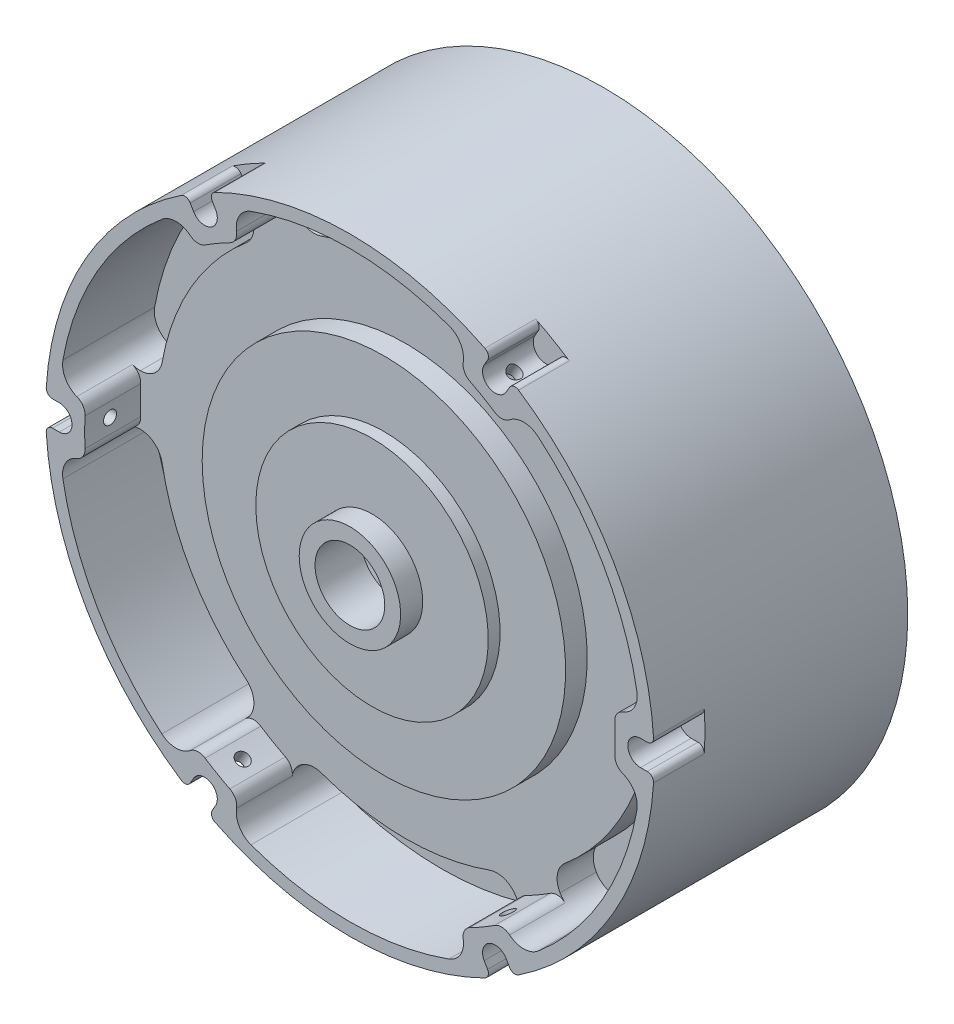
from build123d import *
from build123d.topology import SkipClean

# Parameters (mm, degrees)
SKETCH5_R                        = 8.73125
CUT_EXTRUDE2_DEPTH               = 126.080494083
BOSS_EXTRUDE2_REACH              = 127.08
CUT_EXTRUDE4_DEPTH               = 12.7
F_30_0_1285_DIAMETER_HOLE1_D     = 3.2639
F_30_0_1285_DIAMETER_HOLE1_DEPTH = 14.614001946
FILLET3_R                        = 5.55625
FILLET5_R                        = 1.5875
CIRPATTERN3_COUNT                = 6
FILLET3_OF_CIRPATTERN3_R         = 5.55625
FILLET5_OF_CIRPATTERN3_R         = 1.5875
SKETCH15_R                       = 66.421
SKETCH15_R_2                     = 61.585998054
CUT_EXTRUDE6_DEPTH               = 13.916871924
FILLET6_R                        = 3.175


# Some blends are built 0.0001 mm under size
with BuildPart() as part:
    # Sketch2 → Revolve1 (revolve)
    with BuildSketch(Plane(origin=(0, 0, 0), x_dir=(1, 0, 0), z_dir=(0, 1, 0))):
        with BuildLine():
            Line((0, 11.176), (0, 0))
            Line((0, 0), (-12.7, 0))
            Line((-12.7, 0), (-12.7, 5.536260026))
            Line((-12.7, 5.536260026), (-29.104166667, 5.536260026))
            Line((-29.104166667, 5.536260026), (-29.104166667, 8.510322958))
            Line((-29.104166667, 8.510322958), (-45.508333333, 8.510322958))
            Line((-45.508333333, 8.510322958), (-45.508333333, 13.916871924))
            Line((-45.508333333, 13.916871924), (-61.9125, 13.916871924))
            Line((-61.9125, 13.916871924), (-61.9125, 22.980468166))
            Line((-61.9125, 22.980468166), (-73.025, 22.980468166))
            Line((-73.025, 22.980468166), (-73.025, 0))
            Line((-73.025, 0), (-76.2, 0))
            Line((-76.2, 0), (-76.2, 46.101))
            Line((-76.2, 46.101), (-76.2, 63.5))
            Line((-76.2, 63.5), (-69.85, 63.5))
            Line((-69.85, 63.5), (-69.85, 46.101))
            add(Edge.make_bspline(
                [(-69.85, 46.101), (-69.85, 11.176), (0, 11.176)],
                knots=[3.141592654, 3.141592654, 3.141592654, 4.71238898, 4.71238898, 4.71238898], degree=2, weights=[1, 0.707106781, 1]))
        make_face()
    revolve(axis=Axis((0, 0, -46.101), (0, 0, 1)))

    # Sketch5 → Cut-Extrude2 (cut, through all)
    with BuildSketch(Plane.XY):
        Circle(SKETCH5_R)
    extrude(amount=-CUT_EXTRUDE2_DEPTH, mode=Mode.SUBTRACT)

    # Boss-Extrude2: up to this face of the body (flat: up to its plane)
    boss_extrude2_end = Plane(part.part.faces().sort_by_distance((63.977958908, 0, -22.980468166))[0])
    # Sketch11 → Boss-Extrude2 (add, up to the picked face)
    with BuildSketch(Plane.XY, mode=Mode.PRIVATE) as boss_extrude2_sk1:
        with BuildLine():
            ThreePointArc((-75.934955719, 6.35), (-74.871667083, 4.6896715), (-76.133825433, 3.175))
            Line((-76.133825433, 3.175), (-72.771, 3.175))
            ThreePointArc((-72.771, 3.175), (-69.596, 0), (-72.771, -3.175))
            Line((-72.771, -3.175), (-76.133825433, -3.175))
            ThreePointArc((-76.133825433, -3.175), (-74.763294431, -4.682883456), (-75.934955719, -6.35))
            Line((-75.934955719, -6.35), (-61.585998054, -6.35))
            Line((-61.585998054, -6.35), (-61.585998054, 6.35))
            Line((-61.585998054, 6.35), (-75.934955719, 6.35))
        make_face()
    boss_extrude2_tool1 = split(extrude(boss_extrude2_sk1.sketch, amount=-BOSS_EXTRUDE2_REACH, mode=Mode.PRIVATE), bisect_by=boss_extrude2_end, keep=Keep.BOTH, mode=Mode.PRIVATE)
    # Sketch11 → Boss-Extrude2 (add, up to the picked face)
    with BuildSketch(Plane.XY, mode=Mode.PRIVATE) as boss_extrude2_sk2:
        with BuildLine():
            Line((-72.771, 3.175), (-76.133825433, 3.175))
            ThreePointArc((-76.133825433, 3.175), (-76.2, 0), (-76.133825433, -3.175))
            Line((-76.133825433, -3.175), (-72.771, -3.175))
            ThreePointArc((-72.771, -3.175), (-69.596, 0), (-72.771, 3.175))
        make_face()
    boss_extrude2_tool2 = split(extrude(boss_extrude2_sk2.sketch, amount=-BOSS_EXTRUDE2_REACH, mode=Mode.PRIVATE), bisect_by=boss_extrude2_end, keep=Keep.BOTH, mode=Mode.PRIVATE)
    boss_extrude2_1 = boss_extrude2_tool1.solids().sort_by(Axis((-67.423428, 0.010074, 0), (0, 0, -1)))[0]
    add(boss_extrude2_1)
    boss_extrude2_2 = boss_extrude2_tool2.solids().sort_by(Axis((-73.185133, 0, 0), (0, 0, -1)))[0]
    add(boss_extrude2_2)
    boss_extrude2 = boss_extrude2_1 + boss_extrude2_2  # Boss-Extrude2 as one shape, for the pattern or mirror that repeats it

    # Sketch12 → Cut-Extrude4 (cut)
    with BuildSketch(Plane.XY):
        with BuildLine():
            Line((-76.133825433, 3.175), (-72.771, 3.175))
            ThreePointArc((-72.771, 3.175), (-69.596, 0), (-72.771, -3.175))
            Line((-72.771, -3.175), (-76.133825433, -3.175))
            ThreePointArc((-76.133825433, -3.175), (-79.308825433, 0), (-76.133825433, 3.175))
        make_face()
    cut_extrude4 = extrude(amount=-CUT_EXTRUDE4_DEPTH, mode=Mode.SUBTRACT)

    # #30 (0.1285) Diameter Hole1
    with Locations(Plane(origin=(-61.585998054, 0, 0), x_dir=(0, 0, -1), z_dir=(1, 0, 0))):
        with Locations((6.35, 0)):
            f_30_0_1285_diameter_hole1 = Hole(F_30_0_1285_DIAMETER_HOLE1_D / 2, depth=F_30_0_1285_DIAMETER_HOLE1_DEPTH)

    # Fillet3
    fillet3_edges = [part.edges().sort_by_distance(p)[0] for p in [
        (-72.748389157, -6.35, -11.490234083),
        (-72.748389157, 6.35, -11.490234083),
        (-61.585998054, -6.35, -18.448670045),
        (-61.585998054, 6.35, -18.448670045),
    ]]
    fillet(fillet3_edges, radius=FILLET3_R - 0.0001)  # a hair under: the kernel refuses the full size

    # Fillet5
    fillet5_edges = [part.edges().sort_by_distance(p)[0] for p in [
        (-76.133825433, -3.175, -6.35),
        (-76.133825433, 3.175, -6.35),
    ]]
    fillet(fillet5_edges, radius=FILLET5_R)

    # CirPattern3: Boss-Extrude2, Cut-Extrude4, #30 (0.1285) Diameter Hole1 ×6 about axis
    with SkipClean():  # the faces are left unmerged after this step: merging them gives an invalid solid
        cirpattern3_axis = Axis((0, 0, 0), (0, 0, 1))
        add([boss_extrude2.rotate(cirpattern3_axis, i * 360 / CIRPATTERN3_COUNT) for i in range(1, CIRPATTERN3_COUNT)])
        add([cut_extrude4.rotate(cirpattern3_axis, i * 360 / CIRPATTERN3_COUNT) for i in range(1, CIRPATTERN3_COUNT)], mode=Mode.SUBTRACT)
        add([f_30_0_1285_diameter_hole1.rotate(cirpattern3_axis, i * 360 / CIRPATTERN3_COUNT) for i in range(1, CIRPATTERN3_COUNT)], mode=Mode.SUBTRACT)

    # Fillet3 of CirPattern3
    fillet3_of_cirpattern3_edges = [part.edges().sort_by_distance(p)[0] for p in [
        (-30.874933265, -66.176953095, -11.490234083),
        (-41.873455893, -59.826953095, -11.490234083),
        (-25.293737713, -56.510038832, -18.448670045),
        (-36.292260341, -50.160038832, -18.448670045),
        (41.873455893, -59.826953095, -11.490234083),
        (30.874933265, -66.176953095, -11.490234083),
        (36.292260341, -50.160038832, -18.448670045),
        (25.293737713, -56.510038832, -18.448670045),
        (72.748389157, 6.35, -11.490234083),
        (72.748389157, -6.35, -11.490234083),
        (61.585998054, 6.35, -18.448670045),
        (61.585998054, -6.35, -18.448670045),
        (30.874933265, 66.176953095, -11.490234083),
        (41.873455893, 59.826953095, -11.490234083),
        (25.293737713, 56.510038832, -18.448670045),
        (36.292260341, 50.160038832, -18.448670045),
        (-41.873455893, 59.826953095, -11.490234083),
        (-30.874933265, 66.176953095, -11.490234083),
        (-36.292260341, 50.160038832, -18.448670045),
        (-25.293737713, 56.510038832, -18.448670045),
    ]]
    fillet(fillet3_of_cirpattern3_edges, radius=FILLET3_OF_CIRPATTERN3_R - 0.0001)  # a hair under: the kernel refuses the full size

    # Fillet5 of CirPattern3
    fillet5_of_cirpattern3_edges = [part.edges().sort_by_distance(p)[0] for p in [
        (-35.317282059, -67.521326912, -6.35),
        (-40.816543373, -64.346326912, -6.35),
        (40.816543373, -64.346326912, -6.35),
        (35.317282059, -67.521326912, -6.35),
        (76.133825433, 3.175, -6.35),
        (76.133825433, -3.175, -6.35),
        (35.317282059, 67.521326912, -6.35),
        (40.816543373, 64.346326912, -6.35),
        (-40.816543373, 64.346326912, -6.35),
        (-35.317282059, 67.521326912, -6.35),
    ]]
    fillet(fillet5_of_cirpattern3_edges, radius=FILLET5_OF_CIRPATTERN3_R)

    # Sketch15 → Cut-Extrude6 (cut)
    with BuildSketch(Plane.XY):
        Circle(SKETCH15_R)
        Circle(SKETCH15_R_2, mode=Mode.SUBTRACT)
    extrude(amount=-CUT_EXTRUDE6_DEPTH, mode=Mode.SUBTRACT)

    # Fillet6
    # the kernel refuses this fillet: 3.175 mm, written as the material it takes off along each edge
    with BuildSketch(Plane(origin=(-66.11676596, 6.35, -20.891780238), x_dir=(-0.07467528950499881, -0.997207902664908, 0), z_dir=(0, 0, 1))) as fillet6_piece_1_section:
        with BuildLine():
            CenterArc((2.856644804, -3.174299694), FILLET6_R, 91.203421084, 72.384247986)
            Line((-0.188984069, -2.277210082), (-0.493546956, -2.187501121))
            ThreePointArc((-0.493546956, -2.187501121), (-0.294715491, -0.31613381), (-0.316613509, -0.023709404))
            Line((-0.316613509, -0.023709404), (0.006668172, 0.317429969))
            ThreePointArc((0.006668172, 0.317429969), (1.394981543, 0.302849602), (2.783294914, 0.317429969))
            Line((2.783294914, 0.317429969), (2.789963085, 0))
        make_face()
    fillet6_piece_1 = extrude(amount=27.866687951, mode=Mode.PRIVATE)
    fillet6_piece_1 = split(fillet6_piece_1, bisect_by=Plane(origin=(-66.627757275, 5.727640157, -13.916871924), z_dir=(0, 0, 1)), keep=Keep.TOP, mode=Mode.PRIVATE)
    add(fillet6_piece_1, mode=Mode.SUBTRACT)
    with BuildSketch(Plane(origin=(-66.11676596, -6.35, -20.891780238), x_dir=(-0.9876155238906309, -0.1568935211225585, 0), z_dir=(0, 0, 1))) as fillet6_piece_2_section:
        with BuildLine():
            CenterArc((2.927166017, -3.109388556), FILLET6_R, 101.66826556, 72.384247986)
            Line((-0.230743852, -2.780404879), (-0.546534839, -2.747506512))
            ThreePointArc((-0.546534839, -2.747506512), (-0.417183988, -1.365155268), (-0.316893969, 0.019607713))
            Line((-0.316893969, 0.019607713), (0.049813693, 0.313567929))
            ThreePointArc((0.049813693, 0.313567929), (0.339425199, 0.267559976), (2.220825698, 0.310938856))
            Line((2.220825698, 0.310938856), (2.285038454, 0))
        make_face()
    fillet6_piece_2 = extrude(amount=27.866687951, mode=Mode.PRIVATE)
    fillet6_piece_2 = split(fillet6_piece_2, bisect_by=Plane(origin=(-66.627757275, -5.727640157, -13.916871924), z_dir=(0, 0, 1)), keep=Keep.TOP, mode=Mode.PRIVATE)
    add(fillet6_piece_2, mode=Mode.SUBTRACT)
    with BuildSketch(Plane(origin=(38.557644294, 54.083798937, -20.891780238), x_dir=(-0.8262697318099086, 0.5632746490787435, 0), z_dir=(0, 0, 1))) as fillet6_piece_3_section:
        with BuildLine():
            CenterArc((2.856644804, -3.174299694), FILLET6_R, 91.203421084, 72.384247986)
            Line((-0.188984069, -2.277210082), (-0.493546956, -2.187501121))
            ThreePointArc((-0.493546956, -2.187501121), (-0.294715491, -0.31613381), (-0.316613509, -0.023709404))
            Line((-0.316613509, -0.023709404), (0.006668172, 0.317429969))
            ThreePointArc((0.006668172, 0.317429969), (1.394981543, 0.302849602), (2.783294914, 0.317429969))
            Line((2.783294914, 0.317429969), (2.789963085, 0))
        make_face()
    fillet6_piece_3 = extrude(amount=27.866687951, mode=Mode.PRIVATE)
    fillet6_piece_3 = split(fillet6_piece_3, bisect_by=Plane(origin=(38.274160518, 54.837510319, -13.916871924), z_dir=(0, 0, 1)), keep=Keep.TOP, mode=Mode.PRIVATE)
    add(fillet6_piece_3, mode=Mode.SUBTRACT)
    with BuildSketch(Plane(origin=(-38.557644294, 54.083798937, -20.891780238), x_dir=(-0.6296815369266403, 0.7768533722998853, 0), z_dir=(0, 0, 1))) as fillet6_piece_4_section:
        with BuildLine():
            CenterArc((2.927166017, -3.109388556), FILLET6_R, 101.66826556, 72.384247986)
            Line((-0.230743852, -2.780404879), (-0.546534839, -2.747506512))
            ThreePointArc((-0.546534839, -2.747506512), (-0.417183988, -1.365155268), (-0.316893969, 0.019607713))
            Line((-0.316893969, 0.019607713), (0.049813693, 0.313567929))
            ThreePointArc((0.049813693, 0.313567929), (0.339425199, 0.267559976), (2.220825698, 0.310938856))
            Line((2.220825698, 0.310938856), (2.285038454, 0))
        make_face()
    fillet6_piece_4 = extrude(amount=27.866687951, mode=Mode.PRIVATE)
    fillet6_piece_4 = split(fillet6_piece_4, bisect_by=Plane(origin=(-38.274160518, 54.837510319, -13.916871924), z_dir=(0, 0, 1)), keep=Keep.TOP, mode=Mode.PRIVATE)
    add(fillet6_piece_4, mode=Mode.SUBTRACT)
    with BuildSketch(Plane(origin=(-27.559121666, 60.433798937, -20.891780238), x_dir=(-0.9009450213149103, -0.4339332535861662, 0), z_dir=(0, 0, 1))) as fillet6_piece_5_section:
        with BuildLine():
            CenterArc((2.856644804, -3.174299694), FILLET6_R, 91.203421084, 72.384247986)
            Line((-0.188984069, -2.277210082), (-0.493546956, -2.187501121))
            ThreePointArc((-0.493546956, -2.187501121), (-0.294715491, -0.31613381), (-0.316613509, -0.023709404))
            Line((-0.316613509, -0.023709404), (0.006668172, 0.317429969))
            ThreePointArc((0.006668172, 0.317429969), (1.394981543, 0.302849602), (2.783294914, 0.317429969))
            Line((2.783294914, 0.317429969), (2.789963085, 0))
        make_face()
    fillet6_piece_5 = extrude(amount=27.866687951, mode=Mode.PRIVATE)
    fillet6_piece_5 = split(fillet6_piece_5, bisect_by=Plane(origin=(-28.353596758, 60.565150476, -13.916871924), z_dir=(0, 0, 1)), keep=Keep.TOP, mode=Mode.PRIVATE)
    add(fillet6_piece_5, mode=Mode.SUBTRACT)
    with BuildSketch(Plane(origin=(27.559121666, 60.433798937, -20.891780238), x_dir=(0.35793398696398865, 0.933746893422443, 0), z_dir=(0, 0, 1))) as fillet6_piece_6_section:
        with BuildLine():
            CenterArc((2.927166017, -3.109388556), FILLET6_R, 101.66826556, 72.384247986)
            Line((-0.230743852, -2.780404879), (-0.546534839, -2.747506512))
            ThreePointArc((-0.546534839, -2.747506512), (-0.417183988, -1.365155268), (-0.316893969, 0.019607713))
            Line((-0.316893969, 0.019607713), (0.049813693, 0.313567929))
            ThreePointArc((0.049813693, 0.313567929), (0.339425199, 0.267559976), (2.220825698, 0.310938856))
            Line((2.220825698, 0.310938856), (2.285038454, 0))
        make_face()
    fillet6_piece_6 = extrude(amount=27.866687951, mode=Mode.PRIVATE)
    fillet6_piece_6 = split(fillet6_piece_6, bisect_by=Plane(origin=(28.353596758, 60.565150476, -13.916871924), z_dir=(0, 0, 1)), keep=Keep.TOP, mode=Mode.PRIVATE)
    add(fillet6_piece_6, mode=Mode.SUBTRACT)
    with BuildSketch(Plane(origin=(66.11676596, -6.35, -20.891780238), x_dir=(0.0746752895049996, 0.997207902664908, 0), z_dir=(0, 0, 1))) as fillet6_piece_7_section:
        with BuildLine():
            CenterArc((2.856644804, -3.174299694), FILLET6_R, 91.203421084, 72.384247986)
            Line((-0.188984069, -2.277210082), (-0.493546956, -2.187501121))
            ThreePointArc((-0.493546956, -2.187501121), (-0.294715491, -0.31613381), (-0.316613509, -0.023709404))
            Line((-0.316613509, -0.023709404), (0.006668172, 0.317429969))
            ThreePointArc((0.006668172, 0.317429969), (1.394981543, 0.302849602), (2.783294914, 0.317429969))
            Line((2.783294914, 0.317429969), (2.789963085, 0))
        make_face()
    fillet6_piece_7 = extrude(amount=27.866687951, mode=Mode.PRIVATE)
    fillet6_piece_7 = split(fillet6_piece_7, bisect_by=Plane(origin=(66.627757275, -5.727640157, -13.916871924), z_dir=(0, 0, 1)), keep=Keep.TOP, mode=Mode.PRIVATE)
    add(fillet6_piece_7, mode=Mode.SUBTRACT)
    with BuildSketch(Plane(origin=(66.11676596, 6.35, -20.891780238), x_dir=(0.9876155238906308, 0.15689352112255867, 0), z_dir=(0, 0, 1))) as fillet6_piece_8_section:
        with BuildLine():
            CenterArc((2.927166017, -3.109388556), FILLET6_R, 101.66826556, 72.384247986)
            Line((-0.230743852, -2.780404879), (-0.546534839, -2.747506512))
            ThreePointArc((-0.546534839, -2.747506512), (-0.417183988, -1.365155268), (-0.316893969, 0.019607713))
            Line((-0.316893969, 0.019607713), (0.049813693, 0.313567929))
            ThreePointArc((0.049813693, 0.313567929), (0.339425199, 0.267559976), (2.220825698, 0.310938856))
            Line((2.220825698, 0.310938856), (2.285038454, 0))
        make_face()
    fillet6_piece_8 = extrude(amount=27.866687951, mode=Mode.PRIVATE)
    fillet6_piece_8 = split(fillet6_piece_8, bisect_by=Plane(origin=(66.627757275, 5.727640157, -13.916871924), z_dir=(0, 0, 1)), keep=Keep.TOP, mode=Mode.PRIVATE)
    add(fillet6_piece_8, mode=Mode.SUBTRACT)
    with BuildSketch(Plane(origin=(38.557644294, -54.083798937, -20.891780238), x_dir=(0.6296815369266422, -0.7768533722998838, 0), z_dir=(0, 0, 1))) as fillet6_piece_9_section:
        with BuildLine():
            CenterArc((2.927166017, -3.109388556), FILLET6_R, 101.66826556, 72.384247986)
            Line((-0.230743852, -2.780404879), (-0.546534839, -2.747506512))
            ThreePointArc((-0.546534839, -2.747506512), (-0.417183988, -1.365155268), (-0.316893969, 0.019607713))
            Line((-0.316893969, 0.019607713), (0.049813693, 0.313567929))
            ThreePointArc((0.049813693, 0.313567929), (0.339425199, 0.267559976), (2.220825698, 0.310938856))
            Line((2.220825698, 0.310938856), (2.285038454, 0))
        make_face()
    fillet6_piece_9 = extrude(amount=27.866687951, mode=Mode.PRIVATE)
    fillet6_piece_9 = split(fillet6_piece_9, bisect_by=Plane(origin=(38.274160518, -54.837510319, -13.916871924), z_dir=(0, 0, 1)), keep=Keep.TOP, mode=Mode.PRIVATE)
    add(fillet6_piece_9, mode=Mode.SUBTRACT)
    with BuildSketch(Plane(origin=(27.559121666, -60.433798937, -20.891780238), x_dir=(0.90094502131491, 0.4339332535861667, 0), z_dir=(0, 0, 1))) as fillet6_piece_10_section:
        with BuildLine():
            CenterArc((2.856644804, -3.174299694), FILLET6_R, 91.203421084, 72.384247986)
            Line((-0.188984069, -2.277210082), (-0.493546956, -2.187501121))
            ThreePointArc((-0.493546956, -2.187501121), (-0.294715491, -0.31613381), (-0.316613509, -0.023709404))
            Line((-0.316613509, -0.023709404), (0.006668172, 0.317429969))
            ThreePointArc((0.006668172, 0.317429969), (1.394981543, 0.302849602), (2.783294914, 0.317429969))
            Line((2.783294914, 0.317429969), (2.789963085, 0))
        make_face()
    fillet6_piece_10 = extrude(amount=27.866687951, mode=Mode.PRIVATE)
    fillet6_piece_10 = split(fillet6_piece_10, bisect_by=Plane(origin=(28.353596758, -60.565150476, -13.916871924), z_dir=(0, 0, 1)), keep=Keep.TOP, mode=Mode.PRIVATE)
    add(fillet6_piece_10, mode=Mode.SUBTRACT)
    with BuildSketch(Plane(origin=(-27.559121666, -60.433798937, -20.891780238), x_dir=(-0.35793398696399004, -0.9337468934224424, 0), z_dir=(0, 0, 1))) as fillet6_piece_11_section:
        with BuildLine():
            CenterArc((2.927166017, -3.109388556), FILLET6_R, 101.66826556, 72.384247986)
            Line((-0.230743852, -2.780404879), (-0.546534839, -2.747506512))
            ThreePointArc((-0.546534839, -2.747506512), (-0.417183988, -1.365155268), (-0.316893969, 0.019607713))
            Line((-0.316893969, 0.019607713), (0.049813693, 0.313567929))
            ThreePointArc((0.049813693, 0.313567929), (0.339425199, 0.267559976), (2.220825698, 0.310938856))
            Line((2.220825698, 0.310938856), (2.285038454, 0))
        make_face()
    fillet6_piece_11 = extrude(amount=27.866687951, mode=Mode.PRIVATE)
    fillet6_piece_11 = split(fillet6_piece_11, bisect_by=Plane(origin=(-28.353596758, -60.565150476, -13.916871924), z_dir=(0, 0, 1)), keep=Keep.TOP, mode=Mode.PRIVATE)
    add(fillet6_piece_11, mode=Mode.SUBTRACT)
    with BuildSketch(Plane(origin=(-38.557644294, -54.083798937, -20.891780238), x_dir=(0.82626973180991, -0.5632746490787416, 0), z_dir=(0, 0, 1))) as fillet6_piece_12_section:
        with BuildLine():
            CenterArc((2.856644804, -3.174299694), FILLET6_R, 91.203421084, 72.384247986)
            Line((-0.188984069, -2.277210082), (-0.493546956, -2.187501121))
            ThreePointArc((-0.493546956, -2.187501121), (-0.294715491, -0.31613381), (-0.316613509, -0.023709404))
            Line((-0.316613509, -0.023709404), (0.006668172, 0.317429969))
            ThreePointArc((0.006668172, 0.317429969), (1.394981543, 0.302849602), (2.783294914, 0.317429969))
            Line((2.783294914, 0.317429969), (2.789963085, 0))
        make_face()
    fillet6_piece_12 = extrude(amount=27.866687951, mode=Mode.PRIVATE)
    fillet6_piece_12 = split(fillet6_piece_12, bisect_by=Plane(origin=(-38.274160518, -54.837510319, -13.916871924), z_dir=(0, 0, 1)), keep=Keep.TOP, mode=Mode.PRIVATE)
    add(fillet6_piece_12, mode=Mode.SUBTRACT)


solid = part.part
